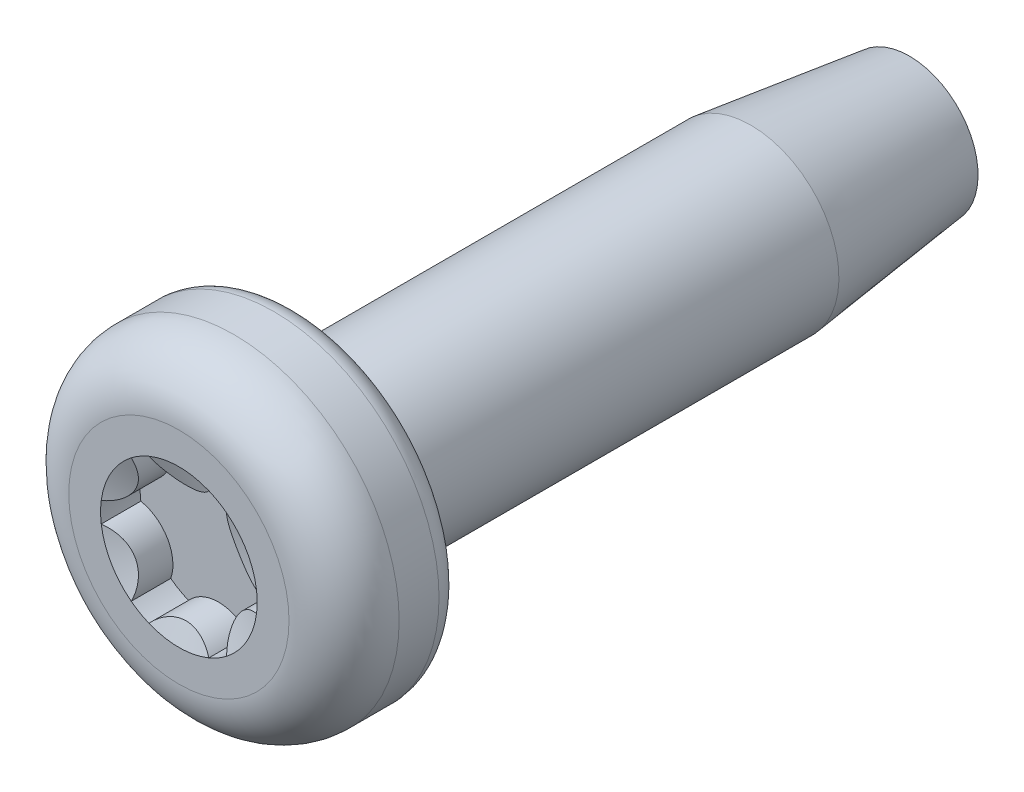
from build123d import *

# Parameters (mm, degrees)
SKETCH1_R          = 3.429
EXTRUDE3_DEPTH     = 2.4638
CUT_EXTRUDE1_DEPTH = 0.821266667


with BuildPart() as part:
    # Sketch17 → Revolve1 (revolve)
    with BuildSketch(Plane(origin=(0, 0, 0), x_dir=(0, 0, -1), z_dir=(1, 0, 0))):
        Polygon((0, 0), (12.7, 0), (12.7, 1.424612871), (11.60272, 1.559341914), (10.50544, 1.694070957), (9.40816, 1.8288), (0, 1.8288), align=None)
    revolve(axis=Axis((0, 0, 0), (0, 0, 1)))

    # Sketch1 → Extrude3 (add)
    with BuildSketch(Plane.XY):
        Circle(SKETCH1_R)
    extrude(amount=EXTRUDE3_DEPTH)

    # Sketch11 → Cut-Revolve3 (revolve, cut)
    with BuildSketch(Plane(origin=(0, 0, 0), x_dir=(0, 0, -1), z_dir=(1, 0, 0))):
        with BuildLine():
            Line((-1.3208, 3.429), (-0.49276, 3.429))
            ThreePointArc((-0.49276, 3.429), (-0.144326063, 3.284673937), (0, 2.93624))
            Line((0, 2.93624), (0.254, 2.93624))
            Line((0.254, 2.93624), (0.254, 3.683))
            Line((0.254, 3.683), (-2.7178, 3.683))
            Line((-2.7178, 3.683), (-2.7178, 2.286))
            Line((-2.7178, 2.286), (-2.4638, 2.286))
            ThreePointArc((-2.4638, 2.286), (-2.129023051, 3.094223051), (-1.3208, 3.429))
        make_face()
    revolve(axis=Axis((0, 0, 0), (0, 0, 1)), mode=Mode.SUBTRACT)

    # Sketch12 → Cut-Extrude1 (cut)
    with BuildSketch(Plane.XY.offset(2.4638)):
        with BuildLine():
            ThreePointArc((0.8128, 1.407810896), (0.718984495, 1.457956329), (0.622090188, 1.501858568))
            ThreePointArc((0.622090188, 1.501858568), (0, 1.2192), (-0.622090188, 1.501858568))
            ThreePointArc((-0.622090188, 1.501858568), (-0.718984495, 1.457956329), (-0.8128, 1.407810896))
            ThreePointArc((-0.8128, 1.407810896), (-0.903134971, 1.351637002), (-0.989602579, 1.28967519))
            ThreePointArc((-0.989602579, 1.28967519), (-1.055858172, 0.6096), (-1.611692767, 0.212183378))
            ThreePointArc((-1.611692767, 0.212183378), (-1.622119466, 0.106319327), (-1.6256, 0))
            ThreePointArc((-1.6256, 0), (-1.622119466, -0.106319327), (-1.611692767, -0.212183378))
            ThreePointArc((-1.611692767, -0.212183378), (-1.055858172, -0.6096), (-0.989602579, -1.28967519))
            ThreePointArc((-0.989602579, -1.28967519), (-0.903134971, -1.351637002), (-0.8128, -1.407810896))
            ThreePointArc((-0.8128, -1.407810896), (-0.718984495, -1.457956329), (-0.622090188, -1.501858568))
            ThreePointArc((-0.622090188, -1.501858568), (0, -1.2192), (0.622090188, -1.501858568))
            ThreePointArc((0.622090188, -1.501858568), (0.718984495, -1.457956329), (0.8128, -1.407810896))
            ThreePointArc((0.8128, -1.407810896), (0.903134971, -1.351637002), (0.989602579, -1.28967519))
            ThreePointArc((0.989602579, -1.28967519), (1.055858172, -0.6096), (1.611692767, -0.212183378))
            ThreePointArc((1.611692767, -0.212183378), (1.622119466, -0.106319327), (1.6256, 0))
            ThreePointArc((1.6256, 0), (1.622119466, 0.106319327), (1.611692767, 0.212183378))
            ThreePointArc((1.611692767, 0.212183378), (1.055858172, 0.6096), (0.989602579, 1.28967519))
            ThreePointArc((0.989602579, 1.28967519), (0.903134971, 1.351637002), (0.8128, 1.407810896))
        make_face()
    extrude(amount=-CUT_EXTRUDE1_DEPTH, mode=Mode.SUBTRACT)

    # Cut-Extrude7 cone 1 section (through the dimple's axis) → Cut-Extrude7 (revolve, cut)
    with BuildSketch(Plane(origin=(0, 0, 2.4638), x_dir=(0, -1, 0), z_dir=(1, 0, 0))):
        Polygon((0, 0), (1.6256, 0), (0, 0.591670013), align=None)
    revolve(axis=Axis((0, 0, 2.4638), (0, 0, -1)), mode=Mode.SUBTRACT)


solid = part.part
